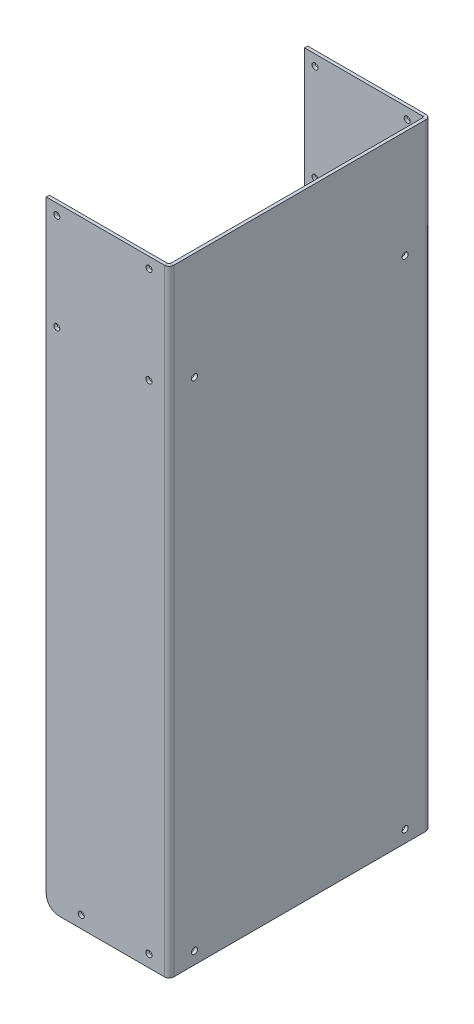
from build123d import *

# Parameters (mm, degrees)
SKETCH1_W               = 124.63
SKETCH1_H               = 304.8
BASE_FLANGE1_DEPTH      = 1.57
EDGE_FLANGE1_DEPTH      = 304.8
EDGE_FLANGE1_BEND_DEPTH = 304.8
FILLET1_R               = 6.35
HOLE1_START             = -64.645
HOLE1_OUTLINE_R         = 1.5
HOLE1_DEPTH             = 129.29
HOLE2_START             = -64.645
HOLE2_OUTLINE_R         = 1.5
HOLE2_DEPTH             = 129.29
SKETCH18_R              = 1.5
CUT_EXTRUDE1_DEPTH      = 10
SKETCH19_R              = 1.5
CUT_EXTRUDE2_DEPTH      = 10


# Read off the part's stored shape, not the designer's step: Hole1, Hole2
# Sheet-metal steps are written as plain solids
with BuildPart() as part:
    # Sketch1 → Base-Flange1 (new body)
    with BuildSketch(Plane(origin=(0, 0, 0), x_dir=(0, 0, -1), z_dir=(1, 0, 0))):
        Rectangle(SKETCH1_W, SKETCH1_H)
    extrude(amount=BASE_FLANGE1_DEPTH)

    # Edge-Flange1 section (across the edge) → Edge-Flange1 (add)
    with BuildSketch(Plane(origin=(0, -152.4, 63.075), x_dir=(0, 0, -1), z_dir=(0, 1, 0))):
        with BuildLine():
            Line((-1.57, 0.76), (-1.57, 59.18))
            Line((-1.57, 59.18), (0, 59.18))
            Line((0, 59.18), (0, 0.76))
            ThreePointArc((0, 0.76), (0.222598846, 0.222598846), (0.76, 0))
            Line((0.76, 0), (0.76, -1.57))
            ThreePointArc((0.76, -1.57), (-0.8875588, -0.8875588), (-1.57, 0.76))
        make_face()
    extrude(amount=EDGE_FLANGE1_DEPTH)

    # Edge-Flange1 section 2 (across the edge) → Edge-Flange1 bend (add)
    with BuildSketch(Plane(origin=(0, 152.4, -63.075), x_dir=(0, 0, 1), z_dir=(0, -1, 0))):
        with BuildLine():
            Line((-1.57, 0.76), (-1.57, 59.18))
            Line((-1.57, 59.18), (0, 59.18))
            Line((0, 59.18), (0, 0.76))
            ThreePointArc((0, 0.76), (0.222598846, 0.222598846), (0.76, 0))
            Line((0.76, 0), (0.76, -1.57))
            ThreePointArc((0.76, -1.57), (-0.8875588, -0.8875588), (-1.57, 0.76))
        make_face()
    extrude(amount=EDGE_FLANGE1_BEND_DEPTH)

    # Fillet1
    fillet1_edges = [part.edges().sort_by_distance(p)[0] for p in [
        (-59.18, -152.4, 63.86),
        (-59.18, -152.4, -63.86),
    ]]
    fillet(fillet1_edges, radius=FILLET1_R)

    # Hole1 outline → Hole1 (cut)
    with BuildSketch(Plane.XY.offset(HOLE1_START)):
        with Locations((-8.39, -146.37)):
            Circle(HOLE1_OUTLINE_R)
        with Locations((-41.86, -146.37)):
            Circle(HOLE1_OUTLINE_R)
    extrude(amount=HOLE1_DEPTH, mode=Mode.SUBTRACT)

    # Hole2 outline → Hole2 (cut)
    with BuildSketch(Plane.XY.offset(HOLE2_START)):
        with Locations((-53.95, 147.08)):
            Circle(HOLE2_OUTLINE_R)
        with Locations((-8.38, 147.08)):
            Circle(HOLE2_OUTLINE_R)
        with Locations((-8.38, 99.28)):
            Circle(HOLE2_OUTLINE_R)
        with Locations((-53.95, 99.28)):
            Circle(HOLE2_OUTLINE_R)
    extrude(amount=HOLE2_DEPTH, mode=Mode.SUBTRACT)

    # Sketch18 → Cut-Extrude1 (cut)
    with BuildSketch(Plane(origin=(1.57, 0, 0), x_dir=(0, 0, -1), z_dir=(1, 0, 0))):
        with Locations((52.085, -146.37)):
            Circle(SKETCH18_R)
    cut_extrude1 = extrude(amount=-CUT_EXTRUDE1_DEPTH, mode=Mode.SUBTRACT)

    # Mirror1: Cut-Extrude1 across plane
    add(cut_extrude1.mirror(Plane.XY), mode=Mode.SUBTRACT)

    # Sketch19 → Cut-Extrude2 (cut)
    with BuildSketch(Plane(origin=(1.57, 0, 0), x_dir=(0, 0, -1), z_dir=(1, 0, 0))):
        with Locations((52.085, 99.28)):
            Circle(SKETCH19_R)
        with Locations((-52.085, 99.28)):
            Circle(SKETCH19_R)
    extrude(amount=-CUT_EXTRUDE2_DEPTH, mode=Mode.SUBTRACT)


solid = part.part
